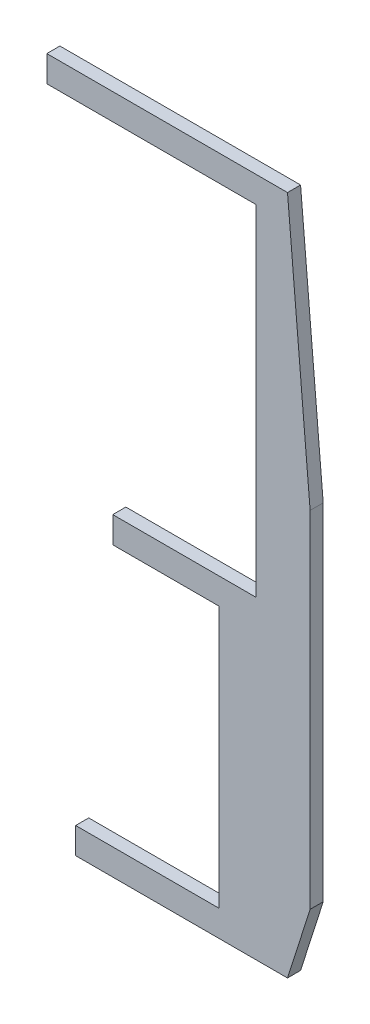
from build123d import *

# Parameters (mm, degrees)
BOSS_EXTRUDE1_DEPTH = 3.175


with BuildPart() as part:
    # Sketch1 → Boss-Extrude1 (new body)
    with BuildSketch(Plane.XY):
        Polygon((0, 0), (50.8, 0), (50.8, -82.55), (16.006948617, -82.55), (16.006948617, -88.9), (41.796049059, -88.9), (41.796049059, -152.4), (7.002997676, -152.4), (7.002997676, -158.75), (58.42, -158.75), (63.908299652, -141.575386567), (63.908299652, -57.719185396), (58.42, 6.35), (0, 6.35), align=None)
    extrude(amount=BOSS_EXTRUDE1_DEPTH)


solid = part.part
